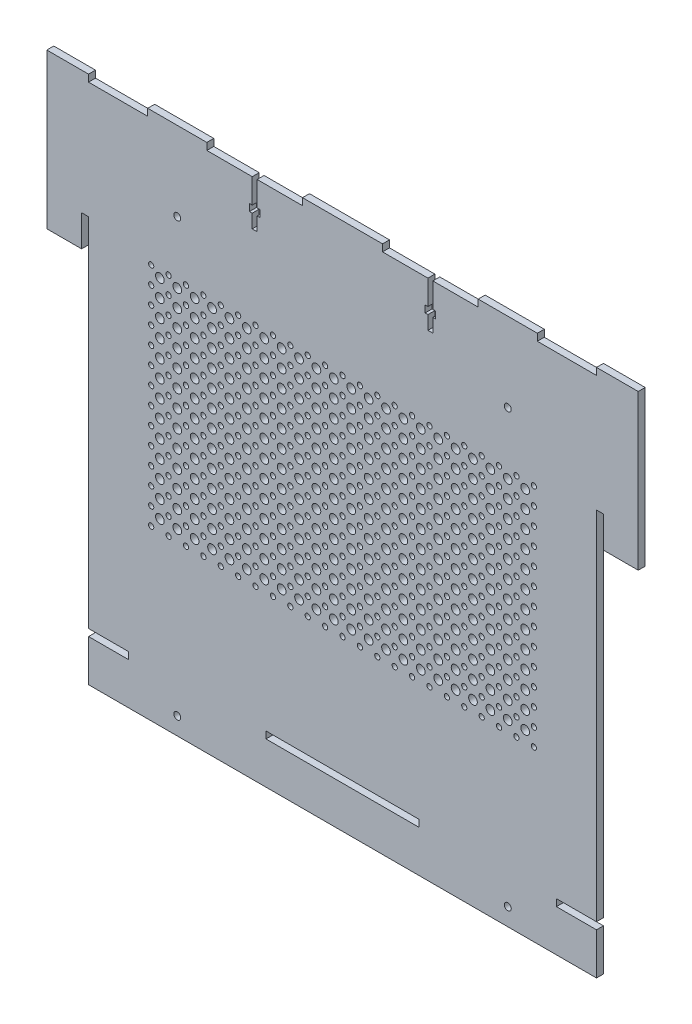
from build123d import *

# Parameters (mm, degrees)
SKETCH1_R           = 2
SKETCH1_W           = 88
SKETCH1_H           = 4
SKETCH1_R_2         = 1.5
SKETCH1_R_3         = 2.5
BOSS_EXTRUDE1_DEPTH = 4


with BuildPart() as part:
    # Sketch1 → Boss-Extrude1 (new body)
    with BuildSketch(Plane.XY):
        Polygon((-146, -152), (146, -152), (146, -128), (122.947368421, -128), (122.947368421, -124), (146, -124), (146, 81), (150, 81), (150, 63), (170, 63), (170, 152), (146, 152), (146, 148), (112, 148), (112, 152), (78, 152), (78, 148), (51.9, 148), (51.9, 133.844684356), (53.5, 133.844684356), (53.5, 129.844684356), (51.9, 129.844684356), (51.9, 122), (49.1, 122), (49.1, 129.844684356), (47.5, 129.844684356), (47.5, 133.844684356), (49.1, 133.844684356), (49.1, 148), (23, 148), (23, 152), (-23, 152), (-23, 148), (-49.1, 148), (-49.1, 133.844684356), (-47.5, 133.844684356), (-47.5, 129.844684356), (-49.1, 129.844684356), (-49.1, 122), (-51.9, 122), (-51.9, 129.844684356), (-53.5, 129.844684356), (-53.5, 133.844684356), (-51.9, 133.844684356), (-51.9, 148), (-78, 148), (-78, 152), (-112, 152), (-112, 148), (-146, 148), (-146, 152), (-170, 152), (-170, 63), (-150, 63), (-150, 81), (-146, 81), (-146, -124), (-122.947368421, -124), (-122.947368421, -128), (-146, -128), align=None)
        with Locations((-95, -142)):
            Circle(SKETCH1_R, mode=Mode.SUBTRACT)
        with Locations((0, -126)):
            Rectangle(SKETCH1_W, SKETCH1_H, mode=Mode.SUBTRACT)
        with Locations((-110, -55)):
            Circle(SKETCH1_R_2, mode=Mode.SUBTRACT)
        with Locations((-110, -45)):
            Circle(SKETCH1_R_2, mode=Mode.SUBTRACT)
        with Locations((-100, -55)):
            Circle(SKETCH1_R_2, mode=Mode.SUBTRACT)
        with Locations((-105, -49)):
            Circle(SKETCH1_R_3, mode=Mode.SUBTRACT)
        with Locations((-90, -55)):
            Circle(SKETCH1_R_2, mode=Mode.SUBTRACT)
        with Locations((-95, -49)):
            Circle(SKETCH1_R_3, mode=Mode.SUBTRACT)
        with Locations((-100, -45)):
            Circle(SKETCH1_R_2, mode=Mode.SUBTRACT)
        with Locations((-105, -39)):
            Circle(SKETCH1_R_3, mode=Mode.SUBTRACT)
        with Locations((-90, -45)):
            Circle(SKETCH1_R_2, mode=Mode.SUBTRACT)
        with Locations((-95, -39)):
            Circle(SKETCH1_R_3, mode=Mode.SUBTRACT)
        with Locations((-110, -35)):
            Circle(SKETCH1_R_2, mode=Mode.SUBTRACT)
        with Locations((-110, -25)):
            Circle(SKETCH1_R_2, mode=Mode.SUBTRACT)
        with Locations((-100, -35)):
            Circle(SKETCH1_R_2, mode=Mode.SUBTRACT)
        with Locations((-105, -29)):
            Circle(SKETCH1_R_3, mode=Mode.SUBTRACT)
        with Locations((-90, -35)):
            Circle(SKETCH1_R_2, mode=Mode.SUBTRACT)
        with Locations((-95, -29)):
            Circle(SKETCH1_R_3, mode=Mode.SUBTRACT)
        with Locations((-100, -25)):
            Circle(SKETCH1_R_2, mode=Mode.SUBTRACT)
        with Locations((-105, -19)):
            Circle(SKETCH1_R_3, mode=Mode.SUBTRACT)
        with Locations((-90, -25)):
            Circle(SKETCH1_R_2, mode=Mode.SUBTRACT)
        with Locations((-95, -19)):
            Circle(SKETCH1_R_3, mode=Mode.SUBTRACT)
        with Locations((-110, -15)):
            Circle(SKETCH1_R_2, mode=Mode.SUBTRACT)
        with Locations((-110, -5)):
            Circle(SKETCH1_R_2, mode=Mode.SUBTRACT)
        with Locations((-100, -15)):
            Circle(SKETCH1_R_2, mode=Mode.SUBTRACT)
        with Locations((-90, -15)):
            Circle(SKETCH1_R_2, mode=Mode.SUBTRACT)
        with Locations((-105, -9)):
            Circle(SKETCH1_R_3, mode=Mode.SUBTRACT)
        with Locations((-100, -5)):
            Circle(SKETCH1_R_2, mode=Mode.SUBTRACT)
        with Locations((-95, -9)):
            Circle(SKETCH1_R_3, mode=Mode.SUBTRACT)
        with Locations((-90, -5)):
            Circle(SKETCH1_R_2, mode=Mode.SUBTRACT)
        with Locations((-80, -55)):
            Circle(SKETCH1_R_2, mode=Mode.SUBTRACT)
        with Locations((-85, -49)):
            Circle(SKETCH1_R_3, mode=Mode.SUBTRACT)
        with Locations((-75, -49)):
            Circle(SKETCH1_R_3, mode=Mode.SUBTRACT)
        with Locations((-70, -55)):
            Circle(SKETCH1_R_2, mode=Mode.SUBTRACT)
        with Locations((-65, -49)):
            Circle(SKETCH1_R_3, mode=Mode.SUBTRACT)
        with Locations((-80, -45)):
            Circle(SKETCH1_R_2, mode=Mode.SUBTRACT)
        with Locations((-85, -39)):
            Circle(SKETCH1_R_3, mode=Mode.SUBTRACT)
        with Locations((-75, -39)):
            Circle(SKETCH1_R_3, mode=Mode.SUBTRACT)
        with Locations((-70, -45)):
            Circle(SKETCH1_R_2, mode=Mode.SUBTRACT)
        with Locations((-65, -39)):
            Circle(SKETCH1_R_3, mode=Mode.SUBTRACT)
        with Locations((-60, -55)):
            Circle(SKETCH1_R_2, mode=Mode.SUBTRACT)
        with Locations((-55, -49)):
            Circle(SKETCH1_R_3, mode=Mode.SUBTRACT)
        with Locations((-50, -55)):
            Circle(SKETCH1_R_2, mode=Mode.SUBTRACT)
        with Locations((-45, -49)):
            Circle(SKETCH1_R_3, mode=Mode.SUBTRACT)
        with Locations((-60, -45)):
            Circle(SKETCH1_R_2, mode=Mode.SUBTRACT)
        with Locations((-55, -39)):
            Circle(SKETCH1_R_3, mode=Mode.SUBTRACT)
        with Locations((-50, -45)):
            Circle(SKETCH1_R_2, mode=Mode.SUBTRACT)
        with Locations((-45, -39)):
            Circle(SKETCH1_R_3, mode=Mode.SUBTRACT)
        with Locations((-40, -55)):
            Circle(SKETCH1_R_2, mode=Mode.SUBTRACT)
        with Locations((-35, -49)):
            Circle(SKETCH1_R_3, mode=Mode.SUBTRACT)
        with Locations((-30, -55)):
            Circle(SKETCH1_R_2, mode=Mode.SUBTRACT)
        with Locations((-25, -49)):
            Circle(SKETCH1_R_3, mode=Mode.SUBTRACT)
        with Locations((-40, -45)):
            Circle(SKETCH1_R_2, mode=Mode.SUBTRACT)
        with Locations((-35, -39)):
            Circle(SKETCH1_R_3, mode=Mode.SUBTRACT)
        with Locations((-30, -45)):
            Circle(SKETCH1_R_2, mode=Mode.SUBTRACT)
        with Locations((-25, -39)):
            Circle(SKETCH1_R_3, mode=Mode.SUBTRACT)
        with Locations((-20, -55)):
            Circle(SKETCH1_R_2, mode=Mode.SUBTRACT)
        with Locations((-15, -49)):
            Circle(SKETCH1_R_3, mode=Mode.SUBTRACT)
        with Locations((-10, -55)):
            Circle(SKETCH1_R_2, mode=Mode.SUBTRACT)
        with Locations((-5, -49)):
            Circle(SKETCH1_R_3, mode=Mode.SUBTRACT)
        with Locations((-20, -45)):
            Circle(SKETCH1_R_2, mode=Mode.SUBTRACT)
        with Locations((-15, -39)):
            Circle(SKETCH1_R_3, mode=Mode.SUBTRACT)
        with Locations((-10, -45)):
            Circle(SKETCH1_R_2, mode=Mode.SUBTRACT)
        with Locations((-5, -39)):
            Circle(SKETCH1_R_3, mode=Mode.SUBTRACT)
        with Locations((-80, -35)):
            Circle(SKETCH1_R_2, mode=Mode.SUBTRACT)
        with Locations((-85, -29)):
            Circle(SKETCH1_R_3, mode=Mode.SUBTRACT)
        with Locations((-75, -29)):
            Circle(SKETCH1_R_3, mode=Mode.SUBTRACT)
        with Locations((-70, -35)):
            Circle(SKETCH1_R_2, mode=Mode.SUBTRACT)
        with Locations((-65, -29)):
            Circle(SKETCH1_R_3, mode=Mode.SUBTRACT)
        with Locations((-80, -25)):
            Circle(SKETCH1_R_2, mode=Mode.SUBTRACT)
        with Locations((-85, -19)):
            Circle(SKETCH1_R_3, mode=Mode.SUBTRACT)
        with Locations((-75, -19)):
            Circle(SKETCH1_R_3, mode=Mode.SUBTRACT)
        with Locations((-70, -25)):
            Circle(SKETCH1_R_2, mode=Mode.SUBTRACT)
        with Locations((-65, -19)):
            Circle(SKETCH1_R_3, mode=Mode.SUBTRACT)
        with Locations((-60, -35)):
            Circle(SKETCH1_R_2, mode=Mode.SUBTRACT)
        with Locations((-55, -29)):
            Circle(SKETCH1_R_3, mode=Mode.SUBTRACT)
        with Locations((-50, -35)):
            Circle(SKETCH1_R_2, mode=Mode.SUBTRACT)
        with Locations((-45, -29)):
            Circle(SKETCH1_R_3, mode=Mode.SUBTRACT)
        with Locations((-60, -25)):
            Circle(SKETCH1_R_2, mode=Mode.SUBTRACT)
        with Locations((-55, -19)):
            Circle(SKETCH1_R_3, mode=Mode.SUBTRACT)
        with Locations((-50, -25)):
            Circle(SKETCH1_R_2, mode=Mode.SUBTRACT)
        with Locations((-45, -19)):
            Circle(SKETCH1_R_3, mode=Mode.SUBTRACT)
        with Locations((-80, -15)):
            Circle(SKETCH1_R_2, mode=Mode.SUBTRACT)
        with Locations((-70, -15)):
            Circle(SKETCH1_R_2, mode=Mode.SUBTRACT)
        with Locations((-85, -9)):
            Circle(SKETCH1_R_3, mode=Mode.SUBTRACT)
        with Locations((-80, -5)):
            Circle(SKETCH1_R_2, mode=Mode.SUBTRACT)
        with Locations((-75, -9)):
            Circle(SKETCH1_R_3, mode=Mode.SUBTRACT)
        with Locations((-70, -5)):
            Circle(SKETCH1_R_2, mode=Mode.SUBTRACT)
        with Locations((-65, -9)):
            Circle(SKETCH1_R_3, mode=Mode.SUBTRACT)
        with Locations((-60, -15)):
            Circle(SKETCH1_R_2, mode=Mode.SUBTRACT)
        with Locations((-50, -15)):
            Circle(SKETCH1_R_2, mode=Mode.SUBTRACT)
        with Locations((-60, -5)):
            Circle(SKETCH1_R_2, mode=Mode.SUBTRACT)
        with Locations((-55, -9)):
            Circle(SKETCH1_R_3, mode=Mode.SUBTRACT)
        with Locations((-50, -5)):
            Circle(SKETCH1_R_2, mode=Mode.SUBTRACT)
        with Locations((-45, -9)):
            Circle(SKETCH1_R_3, mode=Mode.SUBTRACT)
        with Locations((-40, -35)):
            Circle(SKETCH1_R_2, mode=Mode.SUBTRACT)
        with Locations((-35, -29)):
            Circle(SKETCH1_R_3, mode=Mode.SUBTRACT)
        with Locations((-30, -35)):
            Circle(SKETCH1_R_2, mode=Mode.SUBTRACT)
        with Locations((-25, -29)):
            Circle(SKETCH1_R_3, mode=Mode.SUBTRACT)
        with Locations((-40, -25)):
            Circle(SKETCH1_R_2, mode=Mode.SUBTRACT)
        with Locations((-35, -19)):
            Circle(SKETCH1_R_3, mode=Mode.SUBTRACT)
        with Locations((-30, -25)):
            Circle(SKETCH1_R_2, mode=Mode.SUBTRACT)
        with Locations((-25, -19)):
            Circle(SKETCH1_R_3, mode=Mode.SUBTRACT)
        with Locations((-20, -35)):
            Circle(SKETCH1_R_2, mode=Mode.SUBTRACT)
        with Locations((-15, -29)):
            Circle(SKETCH1_R_3, mode=Mode.SUBTRACT)
        with Locations((-10, -35)):
            Circle(SKETCH1_R_2, mode=Mode.SUBTRACT)
        with Locations((-5, -29)):
            Circle(SKETCH1_R_3, mode=Mode.SUBTRACT)
        with Locations((-20, -25)):
            Circle(SKETCH1_R_2, mode=Mode.SUBTRACT)
        with Locations((-15, -19)):
            Circle(SKETCH1_R_3, mode=Mode.SUBTRACT)
        with Locations((-10, -25)):
            Circle(SKETCH1_R_2, mode=Mode.SUBTRACT)
        with Locations((-5, -19)):
            Circle(SKETCH1_R_3, mode=Mode.SUBTRACT)
        with Locations((-40, -15)):
            Circle(SKETCH1_R_2, mode=Mode.SUBTRACT)
        with Locations((-30, -15)):
            Circle(SKETCH1_R_2, mode=Mode.SUBTRACT)
        with Locations((-40, -5)):
            Circle(SKETCH1_R_2, mode=Mode.SUBTRACT)
        with Locations((-35, -9)):
            Circle(SKETCH1_R_3, mode=Mode.SUBTRACT)
        with Locations((-30, -5)):
            Circle(SKETCH1_R_2, mode=Mode.SUBTRACT)
        with Locations((-25, -9)):
            Circle(SKETCH1_R_3, mode=Mode.SUBTRACT)
        with Locations((-20, -15)):
            Circle(SKETCH1_R_2, mode=Mode.SUBTRACT)
        with Locations((-10, -15)):
            Circle(SKETCH1_R_2, mode=Mode.SUBTRACT)
        with Locations((-20, -5)):
            Circle(SKETCH1_R_2, mode=Mode.SUBTRACT)
        with Locations((-15, -9)):
            Circle(SKETCH1_R_3, mode=Mode.SUBTRACT)
        with Locations((-10, -5)):
            Circle(SKETCH1_R_2, mode=Mode.SUBTRACT)
        with Locations((-5, -9)):
            Circle(SKETCH1_R_3, mode=Mode.SUBTRACT)
        with Locations((95, -142)):
            Circle(SKETCH1_R, mode=Mode.SUBTRACT)
        with Locations((0, -55)):
            Circle(SKETCH1_R_2, mode=Mode.SUBTRACT)
        with Locations((10, -55)):
            Circle(SKETCH1_R_2, mode=Mode.SUBTRACT)
        with Locations((5, -49)):
            Circle(SKETCH1_R_3, mode=Mode.SUBTRACT)
        with Locations((20, -55)):
            Circle(SKETCH1_R_2, mode=Mode.SUBTRACT)
        with Locations((15, -49)):
            Circle(SKETCH1_R_3, mode=Mode.SUBTRACT)
        with Locations((0, -45)):
            Circle(SKETCH1_R_2, mode=Mode.SUBTRACT)
        with Locations((10, -45)):
            Circle(SKETCH1_R_2, mode=Mode.SUBTRACT)
        with Locations((5, -39)):
            Circle(SKETCH1_R_3, mode=Mode.SUBTRACT)
        with Locations((20, -45)):
            Circle(SKETCH1_R_2, mode=Mode.SUBTRACT)
        with Locations((15, -39)):
            Circle(SKETCH1_R_3, mode=Mode.SUBTRACT)
        with Locations((30, -55)):
            Circle(SKETCH1_R_2, mode=Mode.SUBTRACT)
        with Locations((25, -49)):
            Circle(SKETCH1_R_3, mode=Mode.SUBTRACT)
        with Locations((40, -55)):
            Circle(SKETCH1_R_2, mode=Mode.SUBTRACT)
        with Locations((35, -49)):
            Circle(SKETCH1_R_3, mode=Mode.SUBTRACT)
        with Locations((30, -45)):
            Circle(SKETCH1_R_2, mode=Mode.SUBTRACT)
        with Locations((25, -39)):
            Circle(SKETCH1_R_3, mode=Mode.SUBTRACT)
        with Locations((40, -45)):
            Circle(SKETCH1_R_2, mode=Mode.SUBTRACT)
        with Locations((35, -39)):
            Circle(SKETCH1_R_3, mode=Mode.SUBTRACT)
        with Locations((50, -55)):
            Circle(SKETCH1_R_2, mode=Mode.SUBTRACT)
        with Locations((45, -49)):
            Circle(SKETCH1_R_3, mode=Mode.SUBTRACT)
        with Locations((60, -55)):
            Circle(SKETCH1_R_2, mode=Mode.SUBTRACT)
        with Locations((55, -49)):
            Circle(SKETCH1_R_3, mode=Mode.SUBTRACT)
        with Locations((50, -45)):
            Circle(SKETCH1_R_2, mode=Mode.SUBTRACT)
        with Locations((45, -39)):
            Circle(SKETCH1_R_3, mode=Mode.SUBTRACT)
        with Locations((60, -45)):
            Circle(SKETCH1_R_2, mode=Mode.SUBTRACT)
        with Locations((55, -39)):
            Circle(SKETCH1_R_3, mode=Mode.SUBTRACT)
        with Locations((70, -55)):
            Circle(SKETCH1_R_2, mode=Mode.SUBTRACT)
        with Locations((65, -49)):
            Circle(SKETCH1_R_3, mode=Mode.SUBTRACT)
        with Locations((80, -55)):
            Circle(SKETCH1_R_2, mode=Mode.SUBTRACT)
        with Locations((75, -49)):
            Circle(SKETCH1_R_3, mode=Mode.SUBTRACT)
        with Locations((70, -45)):
            Circle(SKETCH1_R_2, mode=Mode.SUBTRACT)
        with Locations((65, -39)):
            Circle(SKETCH1_R_3, mode=Mode.SUBTRACT)
        with Locations((80, -45)):
            Circle(SKETCH1_R_2, mode=Mode.SUBTRACT)
        with Locations((75, -39)):
            Circle(SKETCH1_R_3, mode=Mode.SUBTRACT)
        with Locations((0, -35)):
            Circle(SKETCH1_R_2, mode=Mode.SUBTRACT)
        with Locations((10, -35)):
            Circle(SKETCH1_R_2, mode=Mode.SUBTRACT)
        with Locations((5, -29)):
            Circle(SKETCH1_R_3, mode=Mode.SUBTRACT)
        with Locations((20, -35)):
            Circle(SKETCH1_R_2, mode=Mode.SUBTRACT)
        with Locations((15, -29)):
            Circle(SKETCH1_R_3, mode=Mode.SUBTRACT)
        with Locations((0, -25)):
            Circle(SKETCH1_R_2, mode=Mode.SUBTRACT)
        with Locations((10, -25)):
            Circle(SKETCH1_R_2, mode=Mode.SUBTRACT)
        with Locations((5, -19)):
            Circle(SKETCH1_R_3, mode=Mode.SUBTRACT)
        with Locations((20, -25)):
            Circle(SKETCH1_R_2, mode=Mode.SUBTRACT)
        with Locations((15, -19)):
            Circle(SKETCH1_R_3, mode=Mode.SUBTRACT)
        with Locations((30, -35)):
            Circle(SKETCH1_R_2, mode=Mode.SUBTRACT)
        with Locations((25, -29)):
            Circle(SKETCH1_R_3, mode=Mode.SUBTRACT)
        with Locations((40, -35)):
            Circle(SKETCH1_R_2, mode=Mode.SUBTRACT)
        with Locations((35, -29)):
            Circle(SKETCH1_R_3, mode=Mode.SUBTRACT)
        with Locations((30, -25)):
            Circle(SKETCH1_R_2, mode=Mode.SUBTRACT)
        with Locations((25, -19)):
            Circle(SKETCH1_R_3, mode=Mode.SUBTRACT)
        with Locations((40, -25)):
            Circle(SKETCH1_R_2, mode=Mode.SUBTRACT)
        with Locations((35, -19)):
            Circle(SKETCH1_R_3, mode=Mode.SUBTRACT)
        with Locations((0, -15)):
            Circle(SKETCH1_R_2, mode=Mode.SUBTRACT)
        with Locations((10, -15)):
            Circle(SKETCH1_R_2, mode=Mode.SUBTRACT)
        with Locations((20, -15)):
            Circle(SKETCH1_R_2, mode=Mode.SUBTRACT)
        with Locations((5, -9)):
            Circle(SKETCH1_R_3, mode=Mode.SUBTRACT)
        with Locations((0, -5)):
            Circle(SKETCH1_R_2, mode=Mode.SUBTRACT)
        with Locations((10, -5)):
            Circle(SKETCH1_R_2, mode=Mode.SUBTRACT)
        with Locations((15, -9)):
            Circle(SKETCH1_R_3, mode=Mode.SUBTRACT)
        with Locations((20, -5)):
            Circle(SKETCH1_R_2, mode=Mode.SUBTRACT)
        with Locations((30, -15)):
            Circle(SKETCH1_R_2, mode=Mode.SUBTRACT)
        with Locations((40, -15)):
            Circle(SKETCH1_R_2, mode=Mode.SUBTRACT)
        with Locations((25, -9)):
            Circle(SKETCH1_R_3, mode=Mode.SUBTRACT)
        with Locations((30, -5)):
            Circle(SKETCH1_R_2, mode=Mode.SUBTRACT)
        with Locations((35, -9)):
            Circle(SKETCH1_R_3, mode=Mode.SUBTRACT)
        with Locations((40, -5)):
            Circle(SKETCH1_R_2, mode=Mode.SUBTRACT)
        with Locations((50, -35)):
            Circle(SKETCH1_R_2, mode=Mode.SUBTRACT)
        with Locations((45, -29)):
            Circle(SKETCH1_R_3, mode=Mode.SUBTRACT)
        with Locations((60, -35)):
            Circle(SKETCH1_R_2, mode=Mode.SUBTRACT)
        with Locations((55, -29)):
            Circle(SKETCH1_R_3, mode=Mode.SUBTRACT)
        with Locations((50, -25)):
            Circle(SKETCH1_R_2, mode=Mode.SUBTRACT)
        with Locations((45, -19)):
            Circle(SKETCH1_R_3, mode=Mode.SUBTRACT)
        with Locations((60, -25)):
            Circle(SKETCH1_R_2, mode=Mode.SUBTRACT)
        with Locations((55, -19)):
            Circle(SKETCH1_R_3, mode=Mode.SUBTRACT)
        with Locations((70, -35)):
            Circle(SKETCH1_R_2, mode=Mode.SUBTRACT)
        with Locations((65, -29)):
            Circle(SKETCH1_R_3, mode=Mode.SUBTRACT)
        with Locations((80, -35)):
            Circle(SKETCH1_R_2, mode=Mode.SUBTRACT)
        with Locations((75, -29)):
            Circle(SKETCH1_R_3, mode=Mode.SUBTRACT)
        with Locations((70, -25)):
            Circle(SKETCH1_R_2, mode=Mode.SUBTRACT)
        with Locations((65, -19)):
            Circle(SKETCH1_R_3, mode=Mode.SUBTRACT)
        with Locations((80, -25)):
            Circle(SKETCH1_R_2, mode=Mode.SUBTRACT)
        with Locations((75, -19)):
            Circle(SKETCH1_R_3, mode=Mode.SUBTRACT)
        with Locations((50, -15)):
            Circle(SKETCH1_R_2, mode=Mode.SUBTRACT)
        with Locations((60, -15)):
            Circle(SKETCH1_R_2, mode=Mode.SUBTRACT)
        with Locations((45, -9)):
            Circle(SKETCH1_R_3, mode=Mode.SUBTRACT)
        with Locations((50, -5)):
            Circle(SKETCH1_R_2, mode=Mode.SUBTRACT)
        with Locations((55, -9)):
            Circle(SKETCH1_R_3, mode=Mode.SUBTRACT)
        with Locations((60, -5)):
            Circle(SKETCH1_R_2, mode=Mode.SUBTRACT)
        with Locations((70, -15)):
            Circle(SKETCH1_R_2, mode=Mode.SUBTRACT)
        with Locations((80, -15)):
            Circle(SKETCH1_R_2, mode=Mode.SUBTRACT)
        with Locations((65, -9)):
            Circle(SKETCH1_R_3, mode=Mode.SUBTRACT)
        with Locations((70, -5)):
            Circle(SKETCH1_R_2, mode=Mode.SUBTRACT)
        with Locations((75, -9)):
            Circle(SKETCH1_R_3, mode=Mode.SUBTRACT)
        with Locations((80, -5)):
            Circle(SKETCH1_R_2, mode=Mode.SUBTRACT)
        with Locations((90, -55)):
            Circle(SKETCH1_R_2, mode=Mode.SUBTRACT)
        with Locations((85, -49)):
            Circle(SKETCH1_R_3, mode=Mode.SUBTRACT)
        with Locations((95, -49)):
            Circle(SKETCH1_R_3, mode=Mode.SUBTRACT)
        with Locations((100, -55)):
            Circle(SKETCH1_R_2, mode=Mode.SUBTRACT)
        with Locations((105, -49)):
            Circle(SKETCH1_R_3, mode=Mode.SUBTRACT)
        with Locations((90, -45)):
            Circle(SKETCH1_R_2, mode=Mode.SUBTRACT)
        with Locations((85, -39)):
            Circle(SKETCH1_R_3, mode=Mode.SUBTRACT)
        with Locations((95, -39)):
            Circle(SKETCH1_R_3, mode=Mode.SUBTRACT)
        with Locations((100, -45)):
            Circle(SKETCH1_R_2, mode=Mode.SUBTRACT)
        with Locations((105, -39)):
            Circle(SKETCH1_R_3, mode=Mode.SUBTRACT)
        with Locations((110, -55)):
            Circle(SKETCH1_R_2, mode=Mode.SUBTRACT)
        with Locations((110, -45)):
            Circle(SKETCH1_R_2, mode=Mode.SUBTRACT)
        with Locations((90, -35)):
            Circle(SKETCH1_R_2, mode=Mode.SUBTRACT)
        with Locations((85, -29)):
            Circle(SKETCH1_R_3, mode=Mode.SUBTRACT)
        with Locations((95, -29)):
            Circle(SKETCH1_R_3, mode=Mode.SUBTRACT)
        with Locations((100, -35)):
            Circle(SKETCH1_R_2, mode=Mode.SUBTRACT)
        with Locations((105, -29)):
            Circle(SKETCH1_R_3, mode=Mode.SUBTRACT)
        with Locations((90, -25)):
            Circle(SKETCH1_R_2, mode=Mode.SUBTRACT)
        with Locations((85, -19)):
            Circle(SKETCH1_R_3, mode=Mode.SUBTRACT)
        with Locations((95, -19)):
            Circle(SKETCH1_R_3, mode=Mode.SUBTRACT)
        with Locations((100, -25)):
            Circle(SKETCH1_R_2, mode=Mode.SUBTRACT)
        with Locations((105, -19)):
            Circle(SKETCH1_R_3, mode=Mode.SUBTRACT)
        with Locations((110, -35)):
            Circle(SKETCH1_R_2, mode=Mode.SUBTRACT)
        with Locations((110, -25)):
            Circle(SKETCH1_R_2, mode=Mode.SUBTRACT)
        with Locations((90, -15)):
            Circle(SKETCH1_R_2, mode=Mode.SUBTRACT)
        with Locations((100, -15)):
            Circle(SKETCH1_R_2, mode=Mode.SUBTRACT)
        with Locations((85, -9)):
            Circle(SKETCH1_R_3, mode=Mode.SUBTRACT)
        with Locations((90, -5)):
            Circle(SKETCH1_R_2, mode=Mode.SUBTRACT)
        with Locations((95, -9)):
            Circle(SKETCH1_R_3, mode=Mode.SUBTRACT)
        with Locations((100, -5)):
            Circle(SKETCH1_R_2, mode=Mode.SUBTRACT)
        with Locations((105, -9)):
            Circle(SKETCH1_R_3, mode=Mode.SUBTRACT)
        with Locations((110, -15)):
            Circle(SKETCH1_R_2, mode=Mode.SUBTRACT)
        with Locations((110, -5)):
            Circle(SKETCH1_R_2, mode=Mode.SUBTRACT)
        with Locations((-110, 5)):
            Circle(SKETCH1_R_2, mode=Mode.SUBTRACT)
        with Locations((-110, 15)):
            Circle(SKETCH1_R_2, mode=Mode.SUBTRACT)
        with Locations((-105, 1)):
            Circle(SKETCH1_R_3, mode=Mode.SUBTRACT)
        with Locations((-100, 5)):
            Circle(SKETCH1_R_2, mode=Mode.SUBTRACT)
        with Locations((-95, 1)):
            Circle(SKETCH1_R_3, mode=Mode.SUBTRACT)
        with Locations((-90, 5)):
            Circle(SKETCH1_R_2, mode=Mode.SUBTRACT)
        with Locations((-105, 11)):
            Circle(SKETCH1_R_3, mode=Mode.SUBTRACT)
        with Locations((-100, 15)):
            Circle(SKETCH1_R_2, mode=Mode.SUBTRACT)
        with Locations((-95, 11)):
            Circle(SKETCH1_R_3, mode=Mode.SUBTRACT)
        with Locations((-90, 15)):
            Circle(SKETCH1_R_2, mode=Mode.SUBTRACT)
        with Locations((-110, 25)):
            Circle(SKETCH1_R_2, mode=Mode.SUBTRACT)
        with Locations((-110, 35)):
            Circle(SKETCH1_R_2, mode=Mode.SUBTRACT)
        with Locations((-105, 21)):
            Circle(SKETCH1_R_3, mode=Mode.SUBTRACT)
        with Locations((-100, 25)):
            Circle(SKETCH1_R_2, mode=Mode.SUBTRACT)
        with Locations((-95, 21)):
            Circle(SKETCH1_R_3, mode=Mode.SUBTRACT)
        with Locations((-90, 25)):
            Circle(SKETCH1_R_2, mode=Mode.SUBTRACT)
        with Locations((-105, 31)):
            Circle(SKETCH1_R_3, mode=Mode.SUBTRACT)
        with Locations((-100, 35)):
            Circle(SKETCH1_R_2, mode=Mode.SUBTRACT)
        with Locations((-95, 31)):
            Circle(SKETCH1_R_3, mode=Mode.SUBTRACT)
        with Locations((-90, 35)):
            Circle(SKETCH1_R_2, mode=Mode.SUBTRACT)
        with Locations((-110, 45)):
            Circle(SKETCH1_R_2, mode=Mode.SUBTRACT)
        with Locations((-110, 55)):
            Circle(SKETCH1_R_2, mode=Mode.SUBTRACT)
        with Locations((-105, 41)):
            Circle(SKETCH1_R_3, mode=Mode.SUBTRACT)
        with Locations((-100, 45)):
            Circle(SKETCH1_R_2, mode=Mode.SUBTRACT)
        with Locations((-95, 41)):
            Circle(SKETCH1_R_3, mode=Mode.SUBTRACT)
        with Locations((-90, 45)):
            Circle(SKETCH1_R_2, mode=Mode.SUBTRACT)
        with Locations((-105, 51)):
            Circle(SKETCH1_R_3, mode=Mode.SUBTRACT)
        with Locations((-100, 55)):
            Circle(SKETCH1_R_2, mode=Mode.SUBTRACT)
        with Locations((-95, 51)):
            Circle(SKETCH1_R_3, mode=Mode.SUBTRACT)
        with Locations((-90, 55)):
            Circle(SKETCH1_R_2, mode=Mode.SUBTRACT)
        with Locations((-110, 65)):
            Circle(SKETCH1_R_2, mode=Mode.SUBTRACT)
        with Locations((-110, 75)):
            Circle(SKETCH1_R_2, mode=Mode.SUBTRACT)
        with Locations((-105, 61)):
            Circle(SKETCH1_R_3, mode=Mode.SUBTRACT)
        with Locations((-100, 65)):
            Circle(SKETCH1_R_2, mode=Mode.SUBTRACT)
        with Locations((-95, 61)):
            Circle(SKETCH1_R_3, mode=Mode.SUBTRACT)
        with Locations((-90, 65)):
            Circle(SKETCH1_R_2, mode=Mode.SUBTRACT)
        with Locations((-105, 71)):
            Circle(SKETCH1_R_3, mode=Mode.SUBTRACT)
        with Locations((-100, 75)):
            Circle(SKETCH1_R_2, mode=Mode.SUBTRACT)
        with Locations((-95, 71)):
            Circle(SKETCH1_R_3, mode=Mode.SUBTRACT)
        with Locations((-85, 71)):
            Circle(SKETCH1_R_3, mode=Mode.SUBTRACT)
        with Locations((-90, 75)):
            Circle(SKETCH1_R_2, mode=Mode.SUBTRACT)
        with Locations((-85, 1)):
            Circle(SKETCH1_R_3, mode=Mode.SUBTRACT)
        with Locations((-75, 1)):
            Circle(SKETCH1_R_3, mode=Mode.SUBTRACT)
        with Locations((-80, 5)):
            Circle(SKETCH1_R_2, mode=Mode.SUBTRACT)
        with Locations((-65, 1)):
            Circle(SKETCH1_R_3, mode=Mode.SUBTRACT)
        with Locations((-70, 5)):
            Circle(SKETCH1_R_2, mode=Mode.SUBTRACT)
        with Locations((-85, 11)):
            Circle(SKETCH1_R_3, mode=Mode.SUBTRACT)
        with Locations((-75, 11)):
            Circle(SKETCH1_R_3, mode=Mode.SUBTRACT)
        with Locations((-80, 15)):
            Circle(SKETCH1_R_2, mode=Mode.SUBTRACT)
        with Locations((-65, 11)):
            Circle(SKETCH1_R_3, mode=Mode.SUBTRACT)
        with Locations((-70, 15)):
            Circle(SKETCH1_R_2, mode=Mode.SUBTRACT)
        with Locations((-55, 1)):
            Circle(SKETCH1_R_3, mode=Mode.SUBTRACT)
        with Locations((-60, 5)):
            Circle(SKETCH1_R_2, mode=Mode.SUBTRACT)
        with Locations((-45, 1)):
            Circle(SKETCH1_R_3, mode=Mode.SUBTRACT)
        with Locations((-50, 5)):
            Circle(SKETCH1_R_2, mode=Mode.SUBTRACT)
        with Locations((-55, 11)):
            Circle(SKETCH1_R_3, mode=Mode.SUBTRACT)
        with Locations((-60, 15)):
            Circle(SKETCH1_R_2, mode=Mode.SUBTRACT)
        with Locations((-45, 11)):
            Circle(SKETCH1_R_3, mode=Mode.SUBTRACT)
        with Locations((-50, 15)):
            Circle(SKETCH1_R_2, mode=Mode.SUBTRACT)
        with Locations((-85, 21)):
            Circle(SKETCH1_R_3, mode=Mode.SUBTRACT)
        with Locations((-75, 21)):
            Circle(SKETCH1_R_3, mode=Mode.SUBTRACT)
        with Locations((-80, 25)):
            Circle(SKETCH1_R_2, mode=Mode.SUBTRACT)
        with Locations((-65, 21)):
            Circle(SKETCH1_R_3, mode=Mode.SUBTRACT)
        with Locations((-70, 25)):
            Circle(SKETCH1_R_2, mode=Mode.SUBTRACT)
        with Locations((-85, 31)):
            Circle(SKETCH1_R_3, mode=Mode.SUBTRACT)
        with Locations((-75, 31)):
            Circle(SKETCH1_R_3, mode=Mode.SUBTRACT)
        with Locations((-80, 35)):
            Circle(SKETCH1_R_2, mode=Mode.SUBTRACT)
        with Locations((-65, 31)):
            Circle(SKETCH1_R_3, mode=Mode.SUBTRACT)
        with Locations((-70, 35)):
            Circle(SKETCH1_R_2, mode=Mode.SUBTRACT)
        with Locations((-55, 21)):
            Circle(SKETCH1_R_3, mode=Mode.SUBTRACT)
        with Locations((-60, 25)):
            Circle(SKETCH1_R_2, mode=Mode.SUBTRACT)
        with Locations((-45, 21)):
            Circle(SKETCH1_R_3, mode=Mode.SUBTRACT)
        with Locations((-50, 25)):
            Circle(SKETCH1_R_2, mode=Mode.SUBTRACT)
        with Locations((-55, 31)):
            Circle(SKETCH1_R_3, mode=Mode.SUBTRACT)
        with Locations((-60, 35)):
            Circle(SKETCH1_R_2, mode=Mode.SUBTRACT)
        with Locations((-45, 31)):
            Circle(SKETCH1_R_3, mode=Mode.SUBTRACT)
        with Locations((-50, 35)):
            Circle(SKETCH1_R_2, mode=Mode.SUBTRACT)
        with Locations((-35, 1)):
            Circle(SKETCH1_R_3, mode=Mode.SUBTRACT)
        with Locations((-40, 5)):
            Circle(SKETCH1_R_2, mode=Mode.SUBTRACT)
        with Locations((-25, 1)):
            Circle(SKETCH1_R_3, mode=Mode.SUBTRACT)
        with Locations((-30, 5)):
            Circle(SKETCH1_R_2, mode=Mode.SUBTRACT)
        with Locations((-35, 11)):
            Circle(SKETCH1_R_3, mode=Mode.SUBTRACT)
        with Locations((-40, 15)):
            Circle(SKETCH1_R_2, mode=Mode.SUBTRACT)
        with Locations((-25, 11)):
            Circle(SKETCH1_R_3, mode=Mode.SUBTRACT)
        with Locations((-30, 15)):
            Circle(SKETCH1_R_2, mode=Mode.SUBTRACT)
        with Locations((-15, 1)):
            Circle(SKETCH1_R_3, mode=Mode.SUBTRACT)
        with Locations((-20, 5)):
            Circle(SKETCH1_R_2, mode=Mode.SUBTRACT)
        with Locations((-5, 1)):
            Circle(SKETCH1_R_3, mode=Mode.SUBTRACT)
        with Locations((-10, 5)):
            Circle(SKETCH1_R_2, mode=Mode.SUBTRACT)
        with Locations((-15, 11)):
            Circle(SKETCH1_R_3, mode=Mode.SUBTRACT)
        with Locations((-20, 15)):
            Circle(SKETCH1_R_2, mode=Mode.SUBTRACT)
        with Locations((-5, 11)):
            Circle(SKETCH1_R_3, mode=Mode.SUBTRACT)
        with Locations((-10, 15)):
            Circle(SKETCH1_R_2, mode=Mode.SUBTRACT)
        with Locations((-35, 21)):
            Circle(SKETCH1_R_3, mode=Mode.SUBTRACT)
        with Locations((-40, 25)):
            Circle(SKETCH1_R_2, mode=Mode.SUBTRACT)
        with Locations((-25, 21)):
            Circle(SKETCH1_R_3, mode=Mode.SUBTRACT)
        with Locations((-30, 25)):
            Circle(SKETCH1_R_2, mode=Mode.SUBTRACT)
        with Locations((-35, 31)):
            Circle(SKETCH1_R_3, mode=Mode.SUBTRACT)
        with Locations((-40, 35)):
            Circle(SKETCH1_R_2, mode=Mode.SUBTRACT)
        with Locations((-25, 31)):
            Circle(SKETCH1_R_3, mode=Mode.SUBTRACT)
        with Locations((-30, 35)):
            Circle(SKETCH1_R_2, mode=Mode.SUBTRACT)
        with Locations((-15, 21)):
            Circle(SKETCH1_R_3, mode=Mode.SUBTRACT)
        with Locations((-20, 25)):
            Circle(SKETCH1_R_2, mode=Mode.SUBTRACT)
        with Locations((-5, 21)):
            Circle(SKETCH1_R_3, mode=Mode.SUBTRACT)
        with Locations((-10, 25)):
            Circle(SKETCH1_R_2, mode=Mode.SUBTRACT)
        with Locations((-15, 31)):
            Circle(SKETCH1_R_3, mode=Mode.SUBTRACT)
        with Locations((-20, 35)):
            Circle(SKETCH1_R_2, mode=Mode.SUBTRACT)
        with Locations((-5, 31)):
            Circle(SKETCH1_R_3, mode=Mode.SUBTRACT)
        with Locations((-10, 35)):
            Circle(SKETCH1_R_2, mode=Mode.SUBTRACT)
        with Locations((-85, 41)):
            Circle(SKETCH1_R_3, mode=Mode.SUBTRACT)
        with Locations((-75, 41)):
            Circle(SKETCH1_R_3, mode=Mode.SUBTRACT)
        with Locations((-80, 45)):
            Circle(SKETCH1_R_2, mode=Mode.SUBTRACT)
        with Locations((-65, 41)):
            Circle(SKETCH1_R_3, mode=Mode.SUBTRACT)
        with Locations((-70, 45)):
            Circle(SKETCH1_R_2, mode=Mode.SUBTRACT)
        with Locations((-85, 51)):
            Circle(SKETCH1_R_3, mode=Mode.SUBTRACT)
        with Locations((-75, 51)):
            Circle(SKETCH1_R_3, mode=Mode.SUBTRACT)
        with Locations((-80, 55)):
            Circle(SKETCH1_R_2, mode=Mode.SUBTRACT)
        with Locations((-65, 51)):
            Circle(SKETCH1_R_3, mode=Mode.SUBTRACT)
        with Locations((-70, 55)):
            Circle(SKETCH1_R_2, mode=Mode.SUBTRACT)
        with Locations((-55, 41)):
            Circle(SKETCH1_R_3, mode=Mode.SUBTRACT)
        with Locations((-60, 45)):
            Circle(SKETCH1_R_2, mode=Mode.SUBTRACT)
        with Locations((-45, 41)):
            Circle(SKETCH1_R_3, mode=Mode.SUBTRACT)
        with Locations((-50, 45)):
            Circle(SKETCH1_R_2, mode=Mode.SUBTRACT)
        with Locations((-55, 51)):
            Circle(SKETCH1_R_3, mode=Mode.SUBTRACT)
        with Locations((-60, 55)):
            Circle(SKETCH1_R_2, mode=Mode.SUBTRACT)
        with Locations((-45, 51)):
            Circle(SKETCH1_R_3, mode=Mode.SUBTRACT)
        with Locations((-50, 55)):
            Circle(SKETCH1_R_2, mode=Mode.SUBTRACT)
        with Locations((-85, 61)):
            Circle(SKETCH1_R_3, mode=Mode.SUBTRACT)
        with Locations((-75, 61)):
            Circle(SKETCH1_R_3, mode=Mode.SUBTRACT)
        with Locations((-80, 65)):
            Circle(SKETCH1_R_2, mode=Mode.SUBTRACT)
        with Locations((-65, 61)):
            Circle(SKETCH1_R_3, mode=Mode.SUBTRACT)
        with Locations((-70, 65)):
            Circle(SKETCH1_R_2, mode=Mode.SUBTRACT)
        with Locations((-75, 71)):
            Circle(SKETCH1_R_3, mode=Mode.SUBTRACT)
        with Locations((-80, 75)):
            Circle(SKETCH1_R_2, mode=Mode.SUBTRACT)
        with Locations((-65, 71)):
            Circle(SKETCH1_R_3, mode=Mode.SUBTRACT)
        with Locations((-70, 75)):
            Circle(SKETCH1_R_2, mode=Mode.SUBTRACT)
        with Locations((-55, 61)):
            Circle(SKETCH1_R_3, mode=Mode.SUBTRACT)
        with Locations((-60, 65)):
            Circle(SKETCH1_R_2, mode=Mode.SUBTRACT)
        with Locations((-45, 61)):
            Circle(SKETCH1_R_3, mode=Mode.SUBTRACT)
        with Locations((-50, 65)):
            Circle(SKETCH1_R_2, mode=Mode.SUBTRACT)
        with Locations((-55, 71)):
            Circle(SKETCH1_R_3, mode=Mode.SUBTRACT)
        with Locations((-60, 75)):
            Circle(SKETCH1_R_2, mode=Mode.SUBTRACT)
        with Locations((-45, 71)):
            Circle(SKETCH1_R_3, mode=Mode.SUBTRACT)
        with Locations((-50, 75)):
            Circle(SKETCH1_R_2, mode=Mode.SUBTRACT)
        with Locations((-35, 41)):
            Circle(SKETCH1_R_3, mode=Mode.SUBTRACT)
        with Locations((-40, 45)):
            Circle(SKETCH1_R_2, mode=Mode.SUBTRACT)
        with Locations((-25, 41)):
            Circle(SKETCH1_R_3, mode=Mode.SUBTRACT)
        with Locations((-30, 45)):
            Circle(SKETCH1_R_2, mode=Mode.SUBTRACT)
        with Locations((-35, 51)):
            Circle(SKETCH1_R_3, mode=Mode.SUBTRACT)
        with Locations((-40, 55)):
            Circle(SKETCH1_R_2, mode=Mode.SUBTRACT)
        with Locations((-25, 51)):
            Circle(SKETCH1_R_3, mode=Mode.SUBTRACT)
        with Locations((-30, 55)):
            Circle(SKETCH1_R_2, mode=Mode.SUBTRACT)
        with Locations((-15, 41)):
            Circle(SKETCH1_R_3, mode=Mode.SUBTRACT)
        with Locations((-20, 45)):
            Circle(SKETCH1_R_2, mode=Mode.SUBTRACT)
        with Locations((-5, 41)):
            Circle(SKETCH1_R_3, mode=Mode.SUBTRACT)
        with Locations((-10, 45)):
            Circle(SKETCH1_R_2, mode=Mode.SUBTRACT)
        with Locations((-15, 51)):
            Circle(SKETCH1_R_3, mode=Mode.SUBTRACT)
        with Locations((-20, 55)):
            Circle(SKETCH1_R_2, mode=Mode.SUBTRACT)
        with Locations((-5, 51)):
            Circle(SKETCH1_R_3, mode=Mode.SUBTRACT)
        with Locations((-10, 55)):
            Circle(SKETCH1_R_2, mode=Mode.SUBTRACT)
        with Locations((-35, 61)):
            Circle(SKETCH1_R_3, mode=Mode.SUBTRACT)
        with Locations((-40, 65)):
            Circle(SKETCH1_R_2, mode=Mode.SUBTRACT)
        with Locations((-25, 61)):
            Circle(SKETCH1_R_3, mode=Mode.SUBTRACT)
        with Locations((-30, 65)):
            Circle(SKETCH1_R_2, mode=Mode.SUBTRACT)
        with Locations((-35, 71)):
            Circle(SKETCH1_R_3, mode=Mode.SUBTRACT)
        with Locations((-40, 75)):
            Circle(SKETCH1_R_2, mode=Mode.SUBTRACT)
        with Locations((-25, 71)):
            Circle(SKETCH1_R_3, mode=Mode.SUBTRACT)
        with Locations((-30, 75)):
            Circle(SKETCH1_R_2, mode=Mode.SUBTRACT)
        with Locations((-15, 61)):
            Circle(SKETCH1_R_3, mode=Mode.SUBTRACT)
        with Locations((-20, 65)):
            Circle(SKETCH1_R_2, mode=Mode.SUBTRACT)
        with Locations((-5, 61)):
            Circle(SKETCH1_R_3, mode=Mode.SUBTRACT)
        with Locations((-10, 65)):
            Circle(SKETCH1_R_2, mode=Mode.SUBTRACT)
        with Locations((-15, 71)):
            Circle(SKETCH1_R_3, mode=Mode.SUBTRACT)
        with Locations((-20, 75)):
            Circle(SKETCH1_R_2, mode=Mode.SUBTRACT)
        with Locations((-5, 71)):
            Circle(SKETCH1_R_3, mode=Mode.SUBTRACT)
        with Locations((-10, 75)):
            Circle(SKETCH1_R_2, mode=Mode.SUBTRACT)
        with Locations((0, 75)):
            Circle(SKETCH1_R_2, mode=Mode.SUBTRACT)
        with Locations((-95, 106.5)):
            Circle(SKETCH1_R, mode=Mode.SUBTRACT)
        with Locations((5, 1)):
            Circle(SKETCH1_R_3, mode=Mode.SUBTRACT)
        with Locations((0, 5)):
            Circle(SKETCH1_R_2, mode=Mode.SUBTRACT)
        with Locations((10, 5)):
            Circle(SKETCH1_R_2, mode=Mode.SUBTRACT)
        with Locations((15, 1)):
            Circle(SKETCH1_R_3, mode=Mode.SUBTRACT)
        with Locations((20, 5)):
            Circle(SKETCH1_R_2, mode=Mode.SUBTRACT)
        with Locations((5, 11)):
            Circle(SKETCH1_R_3, mode=Mode.SUBTRACT)
        with Locations((0, 15)):
            Circle(SKETCH1_R_2, mode=Mode.SUBTRACT)
        with Locations((10, 15)):
            Circle(SKETCH1_R_2, mode=Mode.SUBTRACT)
        with Locations((15, 11)):
            Circle(SKETCH1_R_3, mode=Mode.SUBTRACT)
        with Locations((20, 15)):
            Circle(SKETCH1_R_2, mode=Mode.SUBTRACT)
        with Locations((25, 1)):
            Circle(SKETCH1_R_3, mode=Mode.SUBTRACT)
        with Locations((30, 5)):
            Circle(SKETCH1_R_2, mode=Mode.SUBTRACT)
        with Locations((35, 1)):
            Circle(SKETCH1_R_3, mode=Mode.SUBTRACT)
        with Locations((40, 5)):
            Circle(SKETCH1_R_2, mode=Mode.SUBTRACT)
        with Locations((25, 11)):
            Circle(SKETCH1_R_3, mode=Mode.SUBTRACT)
        with Locations((30, 15)):
            Circle(SKETCH1_R_2, mode=Mode.SUBTRACT)
        with Locations((35, 11)):
            Circle(SKETCH1_R_3, mode=Mode.SUBTRACT)
        with Locations((40, 15)):
            Circle(SKETCH1_R_2, mode=Mode.SUBTRACT)
        with Locations((5, 21)):
            Circle(SKETCH1_R_3, mode=Mode.SUBTRACT)
        with Locations((0, 25)):
            Circle(SKETCH1_R_2, mode=Mode.SUBTRACT)
        with Locations((10, 25)):
            Circle(SKETCH1_R_2, mode=Mode.SUBTRACT)
        with Locations((15, 21)):
            Circle(SKETCH1_R_3, mode=Mode.SUBTRACT)
        with Locations((20, 25)):
            Circle(SKETCH1_R_2, mode=Mode.SUBTRACT)
        with Locations((5, 31)):
            Circle(SKETCH1_R_3, mode=Mode.SUBTRACT)
        with Locations((0, 35)):
            Circle(SKETCH1_R_2, mode=Mode.SUBTRACT)
        with Locations((10, 35)):
            Circle(SKETCH1_R_2, mode=Mode.SUBTRACT)
        with Locations((15, 31)):
            Circle(SKETCH1_R_3, mode=Mode.SUBTRACT)
        with Locations((20, 35)):
            Circle(SKETCH1_R_2, mode=Mode.SUBTRACT)
        with Locations((25, 21)):
            Circle(SKETCH1_R_3, mode=Mode.SUBTRACT)
        with Locations((30, 25)):
            Circle(SKETCH1_R_2, mode=Mode.SUBTRACT)
        with Locations((35, 21)):
            Circle(SKETCH1_R_3, mode=Mode.SUBTRACT)
        with Locations((40, 25)):
            Circle(SKETCH1_R_2, mode=Mode.SUBTRACT)
        with Locations((25, 31)):
            Circle(SKETCH1_R_3, mode=Mode.SUBTRACT)
        with Locations((30, 35)):
            Circle(SKETCH1_R_2, mode=Mode.SUBTRACT)
        with Locations((35, 31)):
            Circle(SKETCH1_R_3, mode=Mode.SUBTRACT)
        with Locations((40, 35)):
            Circle(SKETCH1_R_2, mode=Mode.SUBTRACT)
        with Locations((45, 1)):
            Circle(SKETCH1_R_3, mode=Mode.SUBTRACT)
        with Locations((50, 5)):
            Circle(SKETCH1_R_2, mode=Mode.SUBTRACT)
        with Locations((55, 1)):
            Circle(SKETCH1_R_3, mode=Mode.SUBTRACT)
        with Locations((60, 5)):
            Circle(SKETCH1_R_2, mode=Mode.SUBTRACT)
        with Locations((45, 11)):
            Circle(SKETCH1_R_3, mode=Mode.SUBTRACT)
        with Locations((50, 15)):
            Circle(SKETCH1_R_2, mode=Mode.SUBTRACT)
        with Locations((55, 11)):
            Circle(SKETCH1_R_3, mode=Mode.SUBTRACT)
        with Locations((60, 15)):
            Circle(SKETCH1_R_2, mode=Mode.SUBTRACT)
        with Locations((65, 1)):
            Circle(SKETCH1_R_3, mode=Mode.SUBTRACT)
        with Locations((70, 5)):
            Circle(SKETCH1_R_2, mode=Mode.SUBTRACT)
        with Locations((75, 1)):
            Circle(SKETCH1_R_3, mode=Mode.SUBTRACT)
        with Locations((80, 5)):
            Circle(SKETCH1_R_2, mode=Mode.SUBTRACT)
        with Locations((65, 11)):
            Circle(SKETCH1_R_3, mode=Mode.SUBTRACT)
        with Locations((70, 15)):
            Circle(SKETCH1_R_2, mode=Mode.SUBTRACT)
        with Locations((75, 11)):
            Circle(SKETCH1_R_3, mode=Mode.SUBTRACT)
        with Locations((80, 15)):
            Circle(SKETCH1_R_2, mode=Mode.SUBTRACT)
        with Locations((45, 21)):
            Circle(SKETCH1_R_3, mode=Mode.SUBTRACT)
        with Locations((50, 25)):
            Circle(SKETCH1_R_2, mode=Mode.SUBTRACT)
        with Locations((55, 21)):
            Circle(SKETCH1_R_3, mode=Mode.SUBTRACT)
        with Locations((60, 25)):
            Circle(SKETCH1_R_2, mode=Mode.SUBTRACT)
        with Locations((45, 31)):
            Circle(SKETCH1_R_3, mode=Mode.SUBTRACT)
        with Locations((50, 35)):
            Circle(SKETCH1_R_2, mode=Mode.SUBTRACT)
        with Locations((55, 31)):
            Circle(SKETCH1_R_3, mode=Mode.SUBTRACT)
        with Locations((60, 35)):
            Circle(SKETCH1_R_2, mode=Mode.SUBTRACT)
        with Locations((65, 21)):
            Circle(SKETCH1_R_3, mode=Mode.SUBTRACT)
        with Locations((70, 25)):
            Circle(SKETCH1_R_2, mode=Mode.SUBTRACT)
        with Locations((75, 21)):
            Circle(SKETCH1_R_3, mode=Mode.SUBTRACT)
        with Locations((80, 25)):
            Circle(SKETCH1_R_2, mode=Mode.SUBTRACT)
        with Locations((65, 31)):
            Circle(SKETCH1_R_3, mode=Mode.SUBTRACT)
        with Locations((70, 35)):
            Circle(SKETCH1_R_2, mode=Mode.SUBTRACT)
        with Locations((75, 31)):
            Circle(SKETCH1_R_3, mode=Mode.SUBTRACT)
        with Locations((80, 35)):
            Circle(SKETCH1_R_2, mode=Mode.SUBTRACT)
        with Locations((5, 41)):
            Circle(SKETCH1_R_3, mode=Mode.SUBTRACT)
        with Locations((0, 45)):
            Circle(SKETCH1_R_2, mode=Mode.SUBTRACT)
        with Locations((10, 45)):
            Circle(SKETCH1_R_2, mode=Mode.SUBTRACT)
        with Locations((15, 41)):
            Circle(SKETCH1_R_3, mode=Mode.SUBTRACT)
        with Locations((20, 45)):
            Circle(SKETCH1_R_2, mode=Mode.SUBTRACT)
        with Locations((5, 51)):
            Circle(SKETCH1_R_3, mode=Mode.SUBTRACT)
        with Locations((0, 55)):
            Circle(SKETCH1_R_2, mode=Mode.SUBTRACT)
        with Locations((10, 55)):
            Circle(SKETCH1_R_2, mode=Mode.SUBTRACT)
        with Locations((15, 51)):
            Circle(SKETCH1_R_3, mode=Mode.SUBTRACT)
        with Locations((20, 55)):
            Circle(SKETCH1_R_2, mode=Mode.SUBTRACT)
        with Locations((25, 41)):
            Circle(SKETCH1_R_3, mode=Mode.SUBTRACT)
        with Locations((30, 45)):
            Circle(SKETCH1_R_2, mode=Mode.SUBTRACT)
        with Locations((35, 41)):
            Circle(SKETCH1_R_3, mode=Mode.SUBTRACT)
        with Locations((40, 45)):
            Circle(SKETCH1_R_2, mode=Mode.SUBTRACT)
        with Locations((25, 51)):
            Circle(SKETCH1_R_3, mode=Mode.SUBTRACT)
        with Locations((30, 55)):
            Circle(SKETCH1_R_2, mode=Mode.SUBTRACT)
        with Locations((35, 51)):
            Circle(SKETCH1_R_3, mode=Mode.SUBTRACT)
        with Locations((40, 55)):
            Circle(SKETCH1_R_2, mode=Mode.SUBTRACT)
        with Locations((5, 61)):
            Circle(SKETCH1_R_3, mode=Mode.SUBTRACT)
        with Locations((0, 65)):
            Circle(SKETCH1_R_2, mode=Mode.SUBTRACT)
        with Locations((10, 65)):
            Circle(SKETCH1_R_2, mode=Mode.SUBTRACT)
        with Locations((15, 61)):
            Circle(SKETCH1_R_3, mode=Mode.SUBTRACT)
        with Locations((20, 65)):
            Circle(SKETCH1_R_2, mode=Mode.SUBTRACT)
        with Locations((5, 71)):
            Circle(SKETCH1_R_3, mode=Mode.SUBTRACT)
        with Locations((10, 75)):
            Circle(SKETCH1_R_2, mode=Mode.SUBTRACT)
        with Locations((15, 71)):
            Circle(SKETCH1_R_3, mode=Mode.SUBTRACT)
        with Locations((20, 75)):
            Circle(SKETCH1_R_2, mode=Mode.SUBTRACT)
        with Locations((25, 61)):
            Circle(SKETCH1_R_3, mode=Mode.SUBTRACT)
        with Locations((30, 65)):
            Circle(SKETCH1_R_2, mode=Mode.SUBTRACT)
        with Locations((35, 61)):
            Circle(SKETCH1_R_3, mode=Mode.SUBTRACT)
        with Locations((40, 65)):
            Circle(SKETCH1_R_2, mode=Mode.SUBTRACT)
        with Locations((25, 71)):
            Circle(SKETCH1_R_3, mode=Mode.SUBTRACT)
        with Locations((30, 75)):
            Circle(SKETCH1_R_2, mode=Mode.SUBTRACT)
        with Locations((35, 71)):
            Circle(SKETCH1_R_3, mode=Mode.SUBTRACT)
        with Locations((40, 75)):
            Circle(SKETCH1_R_2, mode=Mode.SUBTRACT)
        with Locations((45, 41)):
            Circle(SKETCH1_R_3, mode=Mode.SUBTRACT)
        with Locations((50, 45)):
            Circle(SKETCH1_R_2, mode=Mode.SUBTRACT)
        with Locations((55, 41)):
            Circle(SKETCH1_R_3, mode=Mode.SUBTRACT)
        with Locations((60, 45)):
            Circle(SKETCH1_R_2, mode=Mode.SUBTRACT)
        with Locations((45, 51)):
            Circle(SKETCH1_R_3, mode=Mode.SUBTRACT)
        with Locations((50, 55)):
            Circle(SKETCH1_R_2, mode=Mode.SUBTRACT)
        with Locations((55, 51)):
            Circle(SKETCH1_R_3, mode=Mode.SUBTRACT)
        with Locations((60, 55)):
            Circle(SKETCH1_R_2, mode=Mode.SUBTRACT)
        with Locations((65, 41)):
            Circle(SKETCH1_R_3, mode=Mode.SUBTRACT)
        with Locations((70, 45)):
            Circle(SKETCH1_R_2, mode=Mode.SUBTRACT)
        with Locations((75, 41)):
            Circle(SKETCH1_R_3, mode=Mode.SUBTRACT)
        with Locations((80, 45)):
            Circle(SKETCH1_R_2, mode=Mode.SUBTRACT)
        with Locations((65, 51)):
            Circle(SKETCH1_R_3, mode=Mode.SUBTRACT)
        with Locations((70, 55)):
            Circle(SKETCH1_R_2, mode=Mode.SUBTRACT)
        with Locations((75, 51)):
            Circle(SKETCH1_R_3, mode=Mode.SUBTRACT)
        with Locations((80, 55)):
            Circle(SKETCH1_R_2, mode=Mode.SUBTRACT)
        with Locations((45, 61)):
            Circle(SKETCH1_R_3, mode=Mode.SUBTRACT)
        with Locations((50, 65)):
            Circle(SKETCH1_R_2, mode=Mode.SUBTRACT)
        with Locations((55, 61)):
            Circle(SKETCH1_R_3, mode=Mode.SUBTRACT)
        with Locations((60, 65)):
            Circle(SKETCH1_R_2, mode=Mode.SUBTRACT)
        with Locations((45, 71)):
            Circle(SKETCH1_R_3, mode=Mode.SUBTRACT)
        with Locations((50, 75)):
            Circle(SKETCH1_R_2, mode=Mode.SUBTRACT)
        with Locations((55, 71)):
            Circle(SKETCH1_R_3, mode=Mode.SUBTRACT)
        with Locations((60, 75)):
            Circle(SKETCH1_R_2, mode=Mode.SUBTRACT)
        with Locations((65, 61)):
            Circle(SKETCH1_R_3, mode=Mode.SUBTRACT)
        with Locations((70, 65)):
            Circle(SKETCH1_R_2, mode=Mode.SUBTRACT)
        with Locations((75, 61)):
            Circle(SKETCH1_R_3, mode=Mode.SUBTRACT)
        with Locations((80, 65)):
            Circle(SKETCH1_R_2, mode=Mode.SUBTRACT)
        with Locations((65, 71)):
            Circle(SKETCH1_R_3, mode=Mode.SUBTRACT)
        with Locations((70, 75)):
            Circle(SKETCH1_R_2, mode=Mode.SUBTRACT)
        with Locations((75, 71)):
            Circle(SKETCH1_R_3, mode=Mode.SUBTRACT)
        with Locations((85, 71)):
            Circle(SKETCH1_R_3, mode=Mode.SUBTRACT)
        with Locations((80, 75)):
            Circle(SKETCH1_R_2, mode=Mode.SUBTRACT)
        with Locations((85, 1)):
            Circle(SKETCH1_R_3, mode=Mode.SUBTRACT)
        with Locations((95, 1)):
            Circle(SKETCH1_R_3, mode=Mode.SUBTRACT)
        with Locations((90, 5)):
            Circle(SKETCH1_R_2, mode=Mode.SUBTRACT)
        with Locations((105, 1)):
            Circle(SKETCH1_R_3, mode=Mode.SUBTRACT)
        with Locations((100, 5)):
            Circle(SKETCH1_R_2, mode=Mode.SUBTRACT)
        with Locations((85, 11)):
            Circle(SKETCH1_R_3, mode=Mode.SUBTRACT)
        with Locations((95, 11)):
            Circle(SKETCH1_R_3, mode=Mode.SUBTRACT)
        with Locations((90, 15)):
            Circle(SKETCH1_R_2, mode=Mode.SUBTRACT)
        with Locations((105, 11)):
            Circle(SKETCH1_R_3, mode=Mode.SUBTRACT)
        with Locations((100, 15)):
            Circle(SKETCH1_R_2, mode=Mode.SUBTRACT)
        with Locations((110, 5)):
            Circle(SKETCH1_R_2, mode=Mode.SUBTRACT)
        with Locations((110, 15)):
            Circle(SKETCH1_R_2, mode=Mode.SUBTRACT)
        with Locations((85, 21)):
            Circle(SKETCH1_R_3, mode=Mode.SUBTRACT)
        with Locations((95, 21)):
            Circle(SKETCH1_R_3, mode=Mode.SUBTRACT)
        with Locations((90, 25)):
            Circle(SKETCH1_R_2, mode=Mode.SUBTRACT)
        with Locations((105, 21)):
            Circle(SKETCH1_R_3, mode=Mode.SUBTRACT)
        with Locations((100, 25)):
            Circle(SKETCH1_R_2, mode=Mode.SUBTRACT)
        with Locations((85, 31)):
            Circle(SKETCH1_R_3, mode=Mode.SUBTRACT)
        with Locations((95, 31)):
            Circle(SKETCH1_R_3, mode=Mode.SUBTRACT)
        with Locations((90, 35)):
            Circle(SKETCH1_R_2, mode=Mode.SUBTRACT)
        with Locations((105, 31)):
            Circle(SKETCH1_R_3, mode=Mode.SUBTRACT)
        with Locations((100, 35)):
            Circle(SKETCH1_R_2, mode=Mode.SUBTRACT)
        with Locations((110, 25)):
            Circle(SKETCH1_R_2, mode=Mode.SUBTRACT)
        with Locations((110, 35)):
            Circle(SKETCH1_R_2, mode=Mode.SUBTRACT)
        with Locations((85, 41)):
            Circle(SKETCH1_R_3, mode=Mode.SUBTRACT)
        with Locations((95, 41)):
            Circle(SKETCH1_R_3, mode=Mode.SUBTRACT)
        with Locations((90, 45)):
            Circle(SKETCH1_R_2, mode=Mode.SUBTRACT)
        with Locations((105, 41)):
            Circle(SKETCH1_R_3, mode=Mode.SUBTRACT)
        with Locations((100, 45)):
            Circle(SKETCH1_R_2, mode=Mode.SUBTRACT)
        with Locations((85, 51)):
            Circle(SKETCH1_R_3, mode=Mode.SUBTRACT)
        with Locations((95, 51)):
            Circle(SKETCH1_R_3, mode=Mode.SUBTRACT)
        with Locations((90, 55)):
            Circle(SKETCH1_R_2, mode=Mode.SUBTRACT)
        with Locations((105, 51)):
            Circle(SKETCH1_R_3, mode=Mode.SUBTRACT)
        with Locations((100, 55)):
            Circle(SKETCH1_R_2, mode=Mode.SUBTRACT)
        with Locations((110, 45)):
            Circle(SKETCH1_R_2, mode=Mode.SUBTRACT)
        with Locations((110, 55)):
            Circle(SKETCH1_R_2, mode=Mode.SUBTRACT)
        with Locations((85, 61)):
            Circle(SKETCH1_R_3, mode=Mode.SUBTRACT)
        with Locations((95, 61)):
            Circle(SKETCH1_R_3, mode=Mode.SUBTRACT)
        with Locations((90, 65)):
            Circle(SKETCH1_R_2, mode=Mode.SUBTRACT)
        with Locations((105, 61)):
            Circle(SKETCH1_R_3, mode=Mode.SUBTRACT)
        with Locations((100, 65)):
            Circle(SKETCH1_R_2, mode=Mode.SUBTRACT)
        with Locations((95, 71)):
            Circle(SKETCH1_R_3, mode=Mode.SUBTRACT)
        with Locations((90, 75)):
            Circle(SKETCH1_R_2, mode=Mode.SUBTRACT)
        with Locations((105, 71)):
            Circle(SKETCH1_R_3, mode=Mode.SUBTRACT)
        with Locations((100, 75)):
            Circle(SKETCH1_R_2, mode=Mode.SUBTRACT)
        with Locations((110, 65)):
            Circle(SKETCH1_R_2, mode=Mode.SUBTRACT)
        with Locations((110, 75)):
            Circle(SKETCH1_R_2, mode=Mode.SUBTRACT)
        with Locations((95, 106.5)):
            Circle(SKETCH1_R, mode=Mode.SUBTRACT)
    extrude(amount=BOSS_EXTRUDE1_DEPTH)


solid = part.part
